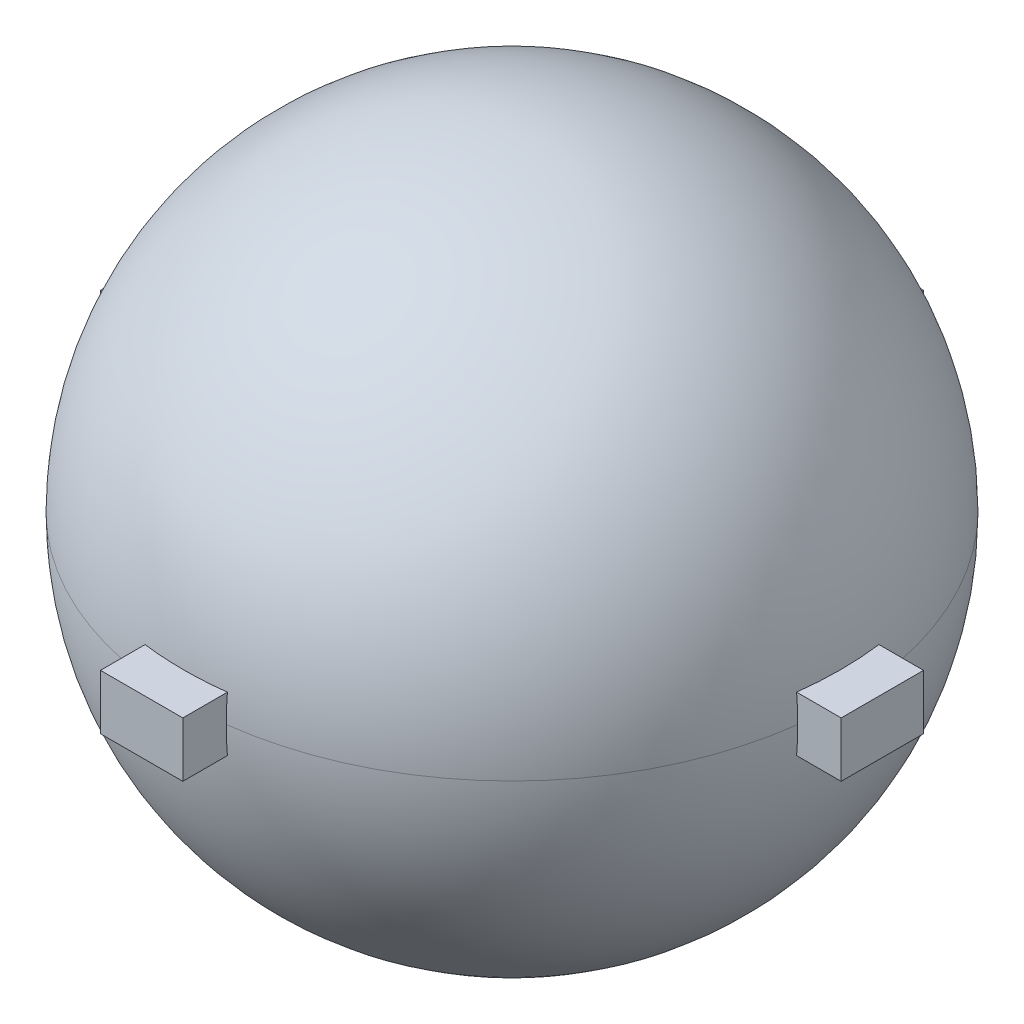
from build123d import *

# Parameters (mm, degrees)
SKETCH1_R                = 304.8
BOSS_EXTRUDE1_DEPTH      = 609.6
FILLET1_R                = 304.8
SHELL2_T                 = 3.175
BOSS_EXTRUDE2_REACH      = 942.01
BOSS_EXTRUDE2_END_RADIUS = 304.8
SKETCH3_W                = 76.2
SKETCH3_H                = 50.8
CIRPATTERN1_START        = 279.4
CIRPATTERN1_DEPTH        = 50.8


with BuildPart() as part:
    # Sketch1 → Boss-Extrude1 (new body)
    with BuildSketch(Plane(origin=(0, 0, 0), x_dir=(1, 0, 0), z_dir=(0, 1, 0))):
        with Locations(Location((0, 0, 0), (0, 0, 90))):
            Circle(SKETCH1_R)
    extrude(amount=BOSS_EXTRUDE1_DEPTH)

    # Fillet1
    fillet1_edges = [part.edges().sort_by_distance(p)[0] for p in [
        (0, 0, 304.8),
        (0, 609.6, 304.8),
    ]]
    fillet(fillet1_edges, radius=FILLET1_R - 0.0001)  # a hair under: the kernel refuses the full size

    # Shell2 (no face opened: a closed hollow body)
    add(offset(amount=-SHELL2_T, mode=Mode.PRIVATE), mode=Mode.SUBTRACT)

    # Boss-Extrude2: up to this sphere (the profile starts outside it)
    boss_extrude2_end = Location((0, 304.8, 0)) * Sphere(BOSS_EXTRUDE2_END_RADIUS, mode=Mode.PRIVATE)
    # Sketch3 → Boss-Extrude2 (add, up to the surface)
    with BuildSketch(Plane(origin=(342.5825, 0, 0), x_dir=(0, 0, -1), z_dir=(1, 0, 0)), mode=Mode.PRIVATE) as boss_extrude2_sk1:
        with Locations((0, 304.8)):
            Rectangle(SKETCH3_W, SKETCH3_H)
    boss_extrude2_tool1 = extrude(boss_extrude2_sk1.sketch, amount=-BOSS_EXTRUDE2_REACH, mode=Mode.PRIVATE) - boss_extrude2_end
    add(boss_extrude2_tool1.solids().sort_by_distance((342.5825, 304.8, 0))[0])

    # CirPattern1: read off the stored shape, not the designer's step
    # CirPattern1 outline → CirPattern1 (add)
    with BuildSketch(Plane(origin=(0, 0, 0), x_dir=(1, 0, 0), z_dir=(0, 1, 0)).offset(CIRPATTERN1_START)):
        with BuildLine():
            ThreePointArc((38.1, -301.34078715), (0, -303.739822875), (-38.1, -301.34078715))
            Line((-38.1, -301.34078715), (-38.1, -342.5825))
            Line((-38.1, -342.5825), (38.1, -342.5825))
            Line((38.1, -342.5825), (38.1, -301.34078715))
        make_face()
        with BuildLine():
            ThreePointArc((-301.34078715, -38.1), (-303.739822875, 0), (-301.34078715, 38.1))
            Line((-301.34078715, 38.1), (-342.5825, 38.1))
            Line((-342.5825, 38.1), (-342.5825, -38.1))
            Line((-342.5825, -38.1), (-301.34078715, -38.1))
        make_face()
        with BuildLine():
            ThreePointArc((-38.1, 301.34078715), (0, 303.739822875), (38.1, 301.34078715))
            Line((38.1, 301.34078715), (38.1, 342.5825))
            Line((38.1, 342.5825), (-38.1, 342.5825))
            Line((-38.1, 342.5825), (-38.1, 301.34078715))
        make_face()
    extrude(amount=CIRPATTERN1_DEPTH)


solid = part.part
